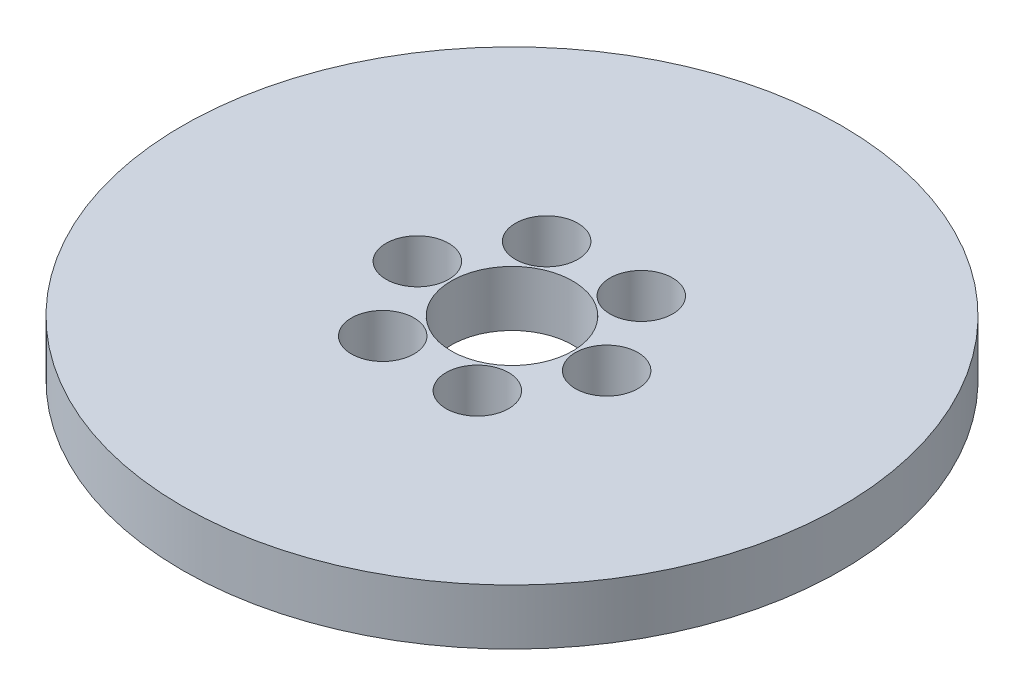
from build123d import *

# Parameters (mm, degrees)
SKETCH1_R           = 95
BOSS_EXTRUDE1_DEPTH = 16
SKETCH2_R           = 17.5
CUT_EXTRUDE1_DEPTH  = 136.299667405
SKETCH3_R           = 9.02133893
CUT_EXTRUDE2_DEPTH  = 15.939313642
CIRPATTERN1_COUNT   = 6


with BuildPart() as part:
    # Sketch1 → Boss-Extrude1 (new body)
    with BuildSketch(Plane(origin=(0, 0, 0), x_dir=(1, 0, 0), z_dir=(0, 1, 0))):
        Circle(SKETCH1_R)
    extrude(amount=BOSS_EXTRUDE1_DEPTH)

    # Sketch2 → Cut-Extrude1 (cut, through all)
    with BuildSketch(Plane(origin=(0, 0, 0), x_dir=(1, 0, 0), z_dir=(0, 1, 0))):
        Circle(SKETCH2_R)
    extrude(amount=CUT_EXTRUDE1_DEPTH, mode=Mode.SUBTRACT)

    # Sketch3 → Cut-Extrude2 (cut)
    with BuildSketch(Plane(origin=(0, 16, 0), x_dir=(1, 0, 0), z_dir=(0, 1, 0))):
        with Locations((-27.28345013, 0)):
            Circle(SKETCH3_R)
    cut_extrude2 = extrude(amount=-CUT_EXTRUDE2_DEPTH, mode=Mode.SUBTRACT)

    # CirPattern1: Cut-Extrude2 ×6 about axis
    cirpattern1_axis = Axis((0, 0, 0), (0, 1, 0))
    for i in range(1, CIRPATTERN1_COUNT):
        add(cut_extrude2.rotate(cirpattern1_axis, i * 360 / CIRPATTERN1_COUNT), mode=Mode.SUBTRACT)


solid = part.part
